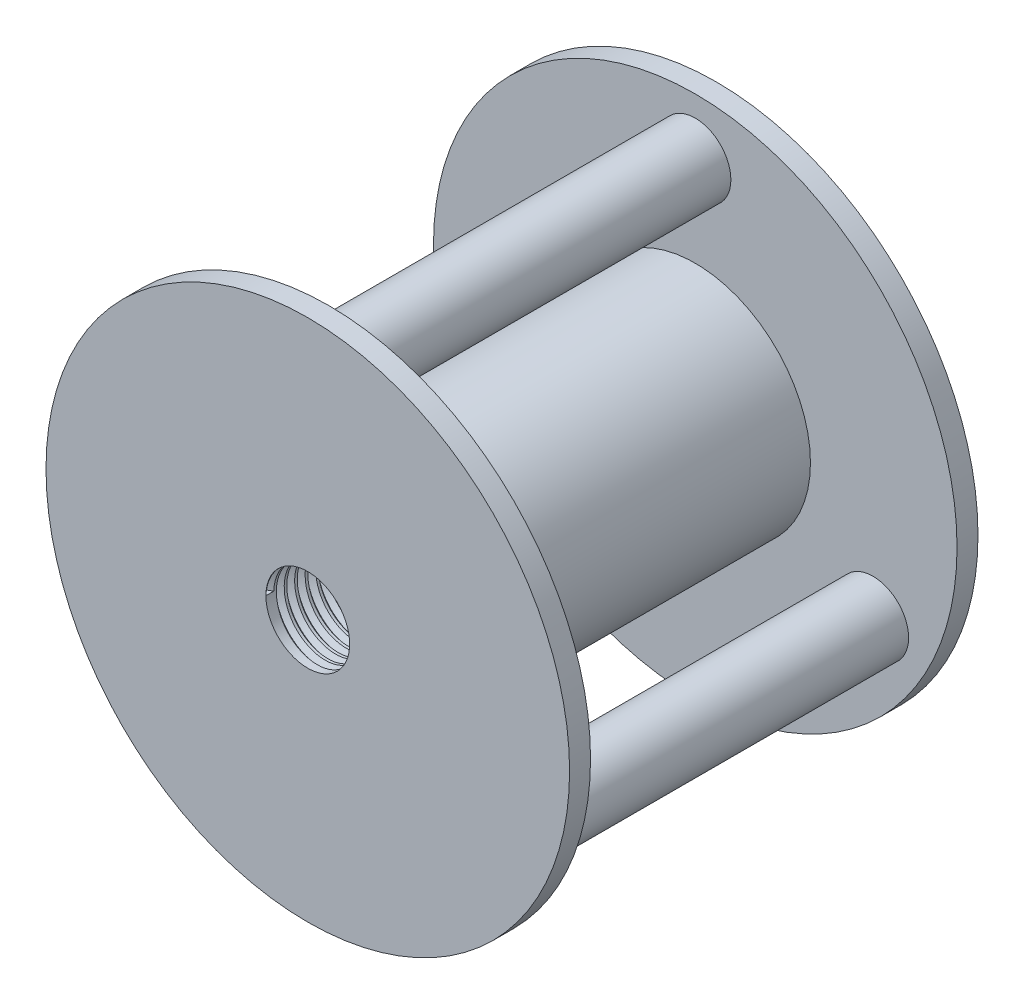
from build123d import *
from build123d.topology import SkipClean

# Parameters (mm, degrees)
SKETCH1_R           = 12.5
BOSS_EXTRUDE1_DEPTH = 1
SKETCH2_R           = 1.7
BOSS_EXTRUDE2_DEPTH = 17.5
SKETCH3_R           = 5.5
BOSS_EXTRUDE3_DEPTH = 8.75
SKETCH4_R           = 2
CUT_EXTRUDE1_DEPTH  = 27.320144377
THREAD1_PITCH       = 0.5
THREAD2_PITCH       = 0.5


with BuildPart() as part:
    # Sketch1 → Boss-Extrude1 (new body)
    with BuildSketch(Plane(origin=(0, 0, 0), x_dir=(0, 1, 0), z_dir=(0, 0, 1))):
        with Locations(Location((0, 0, 0), (0, 0, 270))):
            Circle(SKETCH1_R)
    boss_extrude1 = extrude(amount=BOSS_EXTRUDE1_DEPTH)

    # Sketch2 → Boss-Extrude2 (add)
    with BuildSketch(Plane.XY.offset(1)):
        with Locations((0, 9.8)):
            Circle(SKETCH2_R)
        with Locations((8.487048957, -4.9)):
            Circle(SKETCH2_R)
        with Locations((-8.487048957, -4.9)):
            Circle(SKETCH2_R)
    extrude(amount=BOSS_EXTRUDE2_DEPTH)

    # Sketch3 → Boss-Extrude3 (add)
    with BuildSketch(Plane.XY.offset(1)):
        Circle(SKETCH3_R)
    boss_extrude3 = extrude(amount=BOSS_EXTRUDE3_DEPTH)

    # Mirror2: Boss-Extrude1, Boss-Extrude3 across plane
    add(boss_extrude1.mirror(Plane.XY.offset(9.75)))
    add(boss_extrude3.mirror(Plane.XY.offset(9.75)))

    # Sketch4 → Cut-Extrude1 (cut, through all)
    with BuildSketch(Plane.XY.offset(19.5)):
        Circle(SKETCH4_R)
    extrude(amount=-CUT_EXTRUDE1_DEPTH, mode=Mode.SUBTRACT)

    # Thread1: arcs per turn and ends read off the stored shape
    # Thread1: the profile of Thread Profile1 profile screwed along a right-hand helix through 20 turns, 6 arcs to a turn; built about Z, then put on its axis
    with SkipClean():  # the faces are left unmerged after this step: merging them gives an invalid solid
        thread1_z = Axis((0, 0, 0), (0, 0, 1))
        thread1_corners = [(1.9997, 0, -0.000173205), (2.270632937, 0, 0.156249999), (2.270632937, 0, 0.218749999), (1.9997, 0, 0.375173204)]
        with BuildLine(mode=Mode.PRIVATE) as thread1_profile:
            Line(thread1_corners[0], thread1_corners[1])
            Line(thread1_corners[1], thread1_corners[2])
            Line(thread1_corners[2], thread1_corners[3])
            Line(thread1_corners[3], thread1_corners[0])
        thread1_cap = Face(thread1_profile.wire())
        thread1_turn_angles = [0, 30, 60, 90, 120, 150, 180, 210, 240, 270, 300, 330, 360]
        thread1_turn_weights = [1, 0.8660254037844387, 1, 0.8660254037844387, 1, 0.8660254037844387, 1, 0.8660254037844387, 1, 0.8660254037844387, 1, 0.8660254037844387, 1]
        thread1_turn_rails = [Edge.make_bspline([Vector(p[0], p[1], 0).rotate(thread1_z, thread1_turn_angles[k]) / thread1_turn_weights[k] + Vector(0, 0, p[2] + THREAD1_PITCH * thread1_turn_angles[k] / 360) for k in range(13)], [0, 0, 0, 1, 1, 2, 2, 3, 3, 4, 4, 5, 5, 6, 6, 6], 2, thread1_turn_weights) for p in thread1_corners]
        thread1_turn_sides = [Face.make_surface_from_curves(thread1_turn_rails[p[0]], thread1_turn_rails[p[1]]) for p in [(0, 1), (1, 2), (2, 3), (3, 0)]]
        thread1 = Plane(origin=(0, 0, 19.5), x_dir=(-1, 0, 0), z_dir=(0, 0, -1)) * Solid(Shell([*[p.moved(Location((0, 0, THREAD1_PITCH * i))) for i in range(20) for p in thread1_turn_sides], thread1_cap, thread1_cap.rotate(thread1_z, 7200).moved(Location((0, 0, THREAD1_PITCH * 7200 / 360)))]))
        add(thread1, mode=Mode.SUBTRACT)

    # Thread2: arcs per turn and ends read off the stored shape
    # Thread2: the profile of Thread Profile2 profile screwed along a right-hand helix through 20 turns, 6 arcs to a turn; built about Z, then put on its axis
    with SkipClean():  # the faces are left unmerged after this step: merging them gives an invalid solid
        thread2_z = Axis((0, 0, 0), (0, 0, 1))
        thread2_corners = [(1.9997, 0, -0.000173205), (2.270632937, 0, 0.156249999), (2.270632937, 0, 0.218749999), (1.9997, 0, 0.375173204)]
        with BuildLine(mode=Mode.PRIVATE) as thread2_profile:
            Line(thread2_corners[0], thread2_corners[1])
            Line(thread2_corners[1], thread2_corners[2])
            Line(thread2_corners[2], thread2_corners[3])
            Line(thread2_corners[3], thread2_corners[0])
        thread2_cap = Face(thread2_profile.wire())
        thread2_turn_angles = [0, 30, 60, 90, 120, 150, 180, 210, 240, 270, 300, 330, 360]
        thread2_turn_weights = [1, 0.8660254037844387, 1, 0.8660254037844387, 1, 0.8660254037844387, 1, 0.8660254037844387, 1, 0.8660254037844387, 1, 0.8660254037844387, 1]
        thread2_turn_rails = [Edge.make_bspline([Vector(p[0], p[1], 0).rotate(thread2_z, thread2_turn_angles[k]) / thread2_turn_weights[k] + Vector(0, 0, p[2] + THREAD2_PITCH * thread2_turn_angles[k] / 360) for k in range(13)], [0, 0, 0, 1, 1, 2, 2, 3, 3, 4, 4, 5, 5, 6, 6, 6], 2, thread2_turn_weights) for p in thread2_corners]
        thread2_turn_sides = [Face.make_surface_from_curves(thread2_turn_rails[p[0]], thread2_turn_rails[p[1]]) for p in [(0, 1), (1, 2), (2, 3), (3, 0)]]
        thread2 = Plane(origin=(0, 0, 0), x_dir=(1, 0, 0), z_dir=(0, 0, 1)) * Solid(Shell([*[p.moved(Location((0, 0, THREAD2_PITCH * i))) for i in range(20) for p in thread2_turn_sides], thread2_cap, thread2_cap.rotate(thread2_z, 7200).moved(Location((0, 0, THREAD2_PITCH * 7200 / 360)))]))
        add(thread2, mode=Mode.SUBTRACT)


solid = part.part
